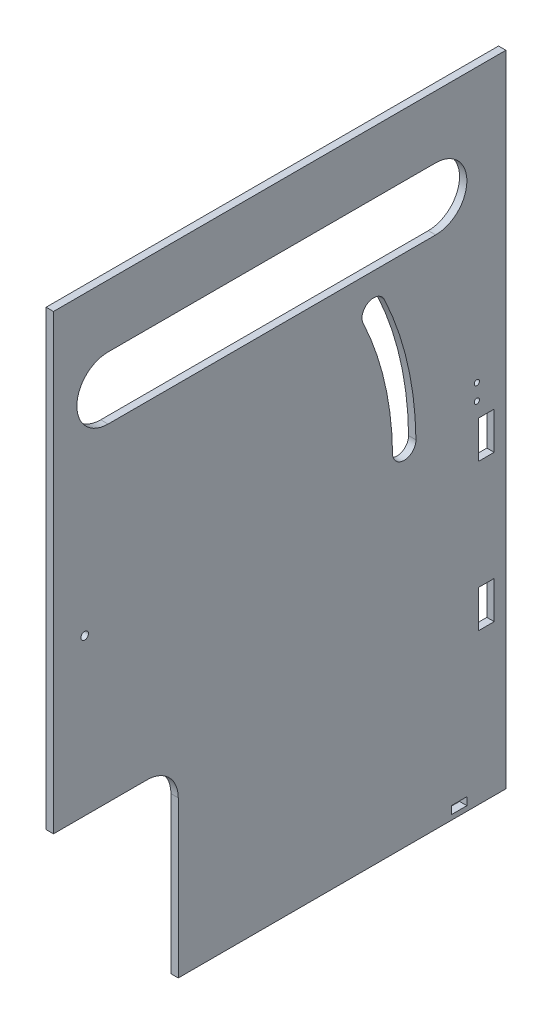
from build123d import *

# Parameters (mm, degrees)
SKETCH1_W           = 184.15
SKETCH1_H           = 260.35
BOSS_EXTRUDE1_DEPTH = 2.9972
CUT_EXTRUDE1_DEPTH  = 160.475137429
SKETCH8_R           = 1.55
SKETCH8_R_2         = 1.0499979
CUT_EXTRUDE7_DEPTH  = 160.475137429
SKETCH9_W           = 50.8
SKETCH9_H           = 76.2
CUT_EXTRUDE8_DEPTH  = 160.475137429
FILLET1_R           = 12.7
CUT_EXTRUDE9_DEPTH  = 160.475137429
SKETCH14_W          = 6.35
SKETCH14_H          = 3.175
CUT_EXTRUDE11_DEPTH = 160.475137429
SKETCH15_W          = 6.35
SKETCH15_H          = 15.24
CUT_EXTRUDE12_DEPTH = 160.475137429


with BuildPart() as part:
    # Sketch1 → Boss-Extrude1 (new body)
    with BuildSketch(Plane(origin=(0, 0, 0), x_dir=(0, 0, -1), z_dir=(1, 0, 0))):
        Rectangle(SKETCH1_W, SKETCH1_H)
    extrude(amount=BOSS_EXTRUDE1_DEPTH)

    # Sketch3 → Cut-Extrude1 (cut, through all)
    with BuildSketch(Plane.ZY):
        with BuildLine():
            Line((69.85, 104.775), (-63.5, 104.775))
            ThreePointArc((-63.5, 104.775), (-75.92139902, 94.720533289), (-68.674996, 80.477180533))
            ThreePointArc((-68.674996, 80.477180533), (-66.145533289, 79.65360098), (-63.5, 79.375))
            Line((-63.5, 79.375), (69.85, 79.375))
            ThreePointArc((69.85, 79.375), (82.55, 92.075), (69.85, 104.775))
        make_face()
    extrude(amount=-CUT_EXTRUDE1_DEPTH, mode=Mode.SUBTRACT)

    # Sketch8 → Cut-Extrude7 (cut, through all)
    with BuildSketch(Plane.ZY):
        with Locations((79.375, 9.525)):
            Circle(SKETCH8_R)
        with Locations((-80.255, 18.9250066)):
            Circle(SKETCH8_R_2)
        with Locations((-80.255, 12.4249942)):
            Circle(SKETCH8_R_2)
    extrude(amount=-CUT_EXTRUDE7_DEPTH, mode=Mode.SUBTRACT)

    # Sketch9 → Cut-Extrude8 (cut, through all)
    with BuildSketch(Plane.ZY):
        with Locations((66.675, -92.075)):
            Rectangle(SKETCH9_W, SKETCH9_H)
    extrude(amount=-CUT_EXTRUDE8_DEPTH, mode=Mode.SUBTRACT)

    # Fillet1
    fillet1_edges = [part.edges().sort_by_distance(p)[0] for p in [
        (1.4986, -53.975, 41.275),
    ]]
    fillet(fillet1_edges, radius=FILLET1_R)

    # Sketch10 → Cut-Extrude9 (cut, through all)
    with BuildSketch(Plane.ZY):
        with BuildLine():
            ThreePointArc((-42.568718673, 67.095364965), (-52.02963985, 39.8142402), (-55.465628749, 11.144346963))
            ThreePointArc((-55.465628749, 11.144346963), (-50.760662504, 6.325000001), (-45.941315542, 11.029966247))
            ThreePointArc((-45.941315542, 11.029966247), (-42.748023806, 37.674794334), (-33.955364022, 63.028948034))
            ThreePointArc((-33.955364022, 63.028948034), (-36.228832832, 69.36883393), (-42.568718673, 67.095364965))
        make_face()
    extrude(amount=-CUT_EXTRUDE9_DEPTH, mode=Mode.SUBTRACT)

    # Sketch14 → Cut-Extrude11 (cut, through all)
    with BuildSketch(Plane(origin=(2.9972, 0, 0), x_dir=(0, 0, -1), z_dir=(1, 0, 0))):
        with Locations((73.025, -126.587504)):
            Rectangle(SKETCH14_W, SKETCH14_H)
    extrude(amount=-CUT_EXTRUDE11_DEPTH, mode=Mode.SUBTRACT)

    # Sketch15 → Cut-Extrude12 (cut, through all)
    with BuildSketch(Plane(origin=(2.9972, 0, 0), x_dir=(0, 0, -1), z_dir=(1, 0, 0))):
        with Locations((84.1375, -1.5450058)):
            Rectangle(SKETCH15_W, SKETCH15_H)
        with Locations((84.1375, -61.2350058)):
            Rectangle(SKETCH15_W, SKETCH15_H)
    extrude(amount=-CUT_EXTRUDE12_DEPTH, mode=Mode.SUBTRACT)


solid = part.part
